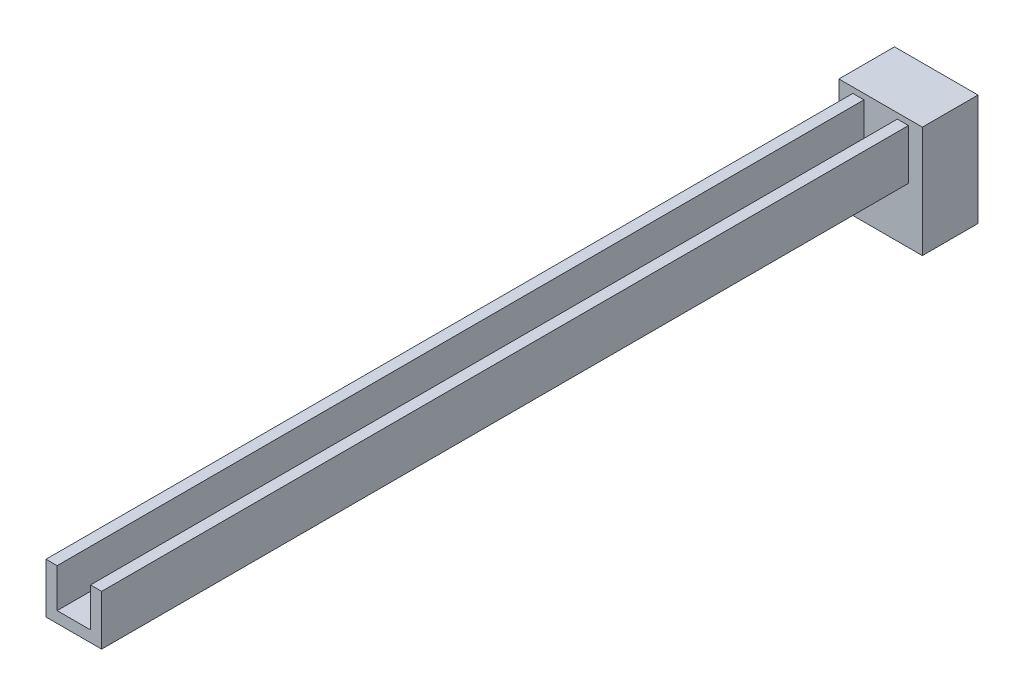
from build123d import *

# Parameters (mm, degrees)
EXTRUDE_1_DEPTH          = 245
SKETCH_2_R               = 2.5
CUT_EXTRUDE_1_DEPTH      = 246.21623111
CUT_EXTRUDE_2_DEPTH      = 246.21623111
CUT_EXTRUDE_2_DEPTH_BACK = 246.21623111
SKETCH_3_W               = 10
SKETCH_3_H               = 100
SKETCH_5_W               = 15
SKETCH_5_H               = 20
EXTRUDE_3_DEPTH          = 10


with BuildPart() as part:
    # ｽｹｯﾁ1 → ﾎﾞｽ - 押し出し1 (new body)
    with BuildSketch(Plane.XY):
        Polygon((-5, 9), (-5, 0), (5, 0), (5, 9), (3, 9), (3, 2), (-3, 2), (-3, 9), align=None)
    extrude(amount=EXTRUDE_1_DEPTH)

    # ｽｹｯﾁ2 → ｶｯﾄ - 押し出し1 (cut, through all)
    with BuildSketch(Plane.XZ):
        with Locations((0, 225)):
            Circle(SKETCH_2_R)
        with Locations((0, 217)):
            Circle(SKETCH_2_R)
        with Locations((0, 122.5)):
            Circle(SKETCH_2_R)
        with Locations((0, 209)):
            Circle(SKETCH_2_R)
        with Locations((0, 193)):
            Circle(SKETCH_2_R)
        with Locations((0, 161)):
            Circle(SKETCH_2_R)
    cut_extrude_1 = extrude(amount=-CUT_EXTRUDE_1_DEPTH, mode=Mode.SUBTRACT)

    # ﾐﾗｰ1: ｶｯﾄ - 押し出し1 across plane
    add(cut_extrude_1.mirror(Plane.XY.offset(122.5)), mode=Mode.SUBTRACT)

    # ｽｹｯﾁ3 → ｶｯﾄ - 押し出し2 (cut, two sides: drawn at the far end of the back side and taken through both)
    with BuildSketch(Plane.XZ.offset(-CUT_EXTRUDE_2_DEPTH_BACK)):
        with Locations((0, 50)):
            Rectangle(SKETCH_3_W, SKETCH_3_H)
    extrude(amount=CUT_EXTRUDE_2_DEPTH + CUT_EXTRUDE_2_DEPTH_BACK, mode=Mode.SUBTRACT)

    # ｽｹｯﾁ5 → ﾎﾞｽ - 押し出し3 (add)
    with BuildSketch(Plane(origin=(0, 0, 100), x_dir=(-1, 0, 0), z_dir=(0, 0, -1))):
        Rectangle(SKETCH_5_W, SKETCH_5_H)
    extrude(amount=EXTRUDE_3_DEPTH)


solid = part.part
